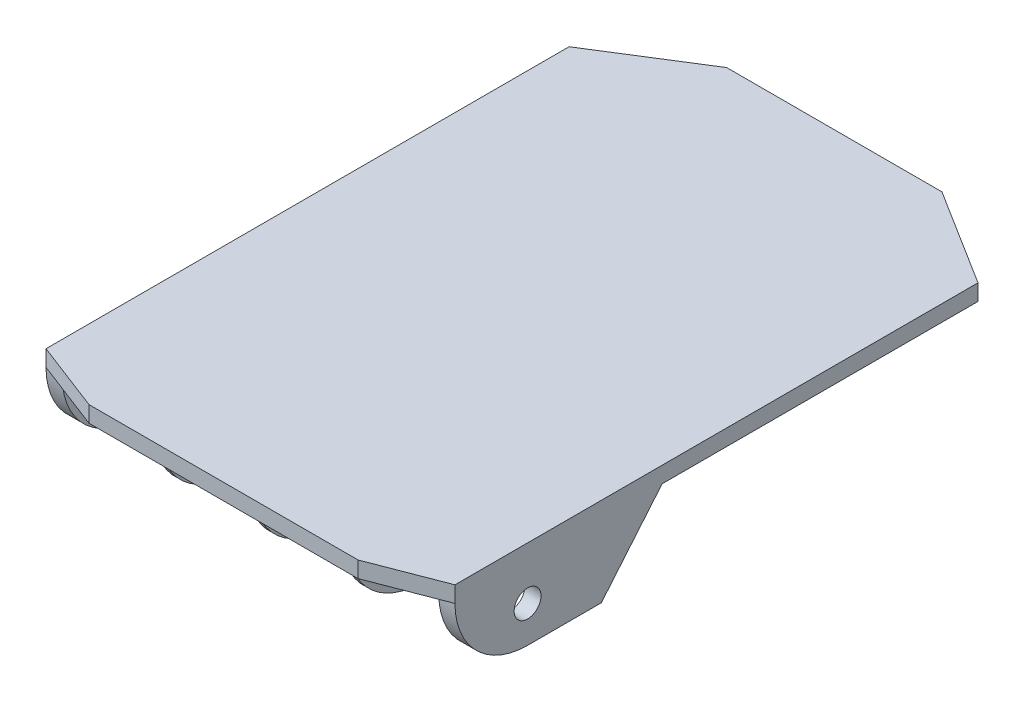
from build123d import *

# Parameters (mm, degrees)
BOSS_EXTRUDE1_DEPTH     = 38
CUT_EXTRUDE1_DEPTH      = 78.345006303
CUT_EXTRUDE1_DEPTH_BACK = 78.345006303
SKETCH2_OUTSIDE_W       = 105.518
SKETCH2_OUTSIDE_H       = 143.018
SHELL1_START            = -13.5
SHELL1_DEPTH            = 13.5
CUT_EXTRUDE2_DEPTH      = 78.345006303
CUT_EXTRUDE2_DEPTH_BACK = 78.345006303
SKETCH3_R               = 2.5
CUT_EXTRUDE3_DEPTH      = 38
SKETCH5_R               = 2.5
BOSS_EXTRUDE2_DEPTH     = 0.5
LPATTERN1_COUNT         = 3
LPATTERN1_PITCH         = 17.5
SKETCH7_W               = 70
SKETCH7_H               = 64.783051232
BOSS_EXTRUDE3_DEPTH     = 3


# Read off the part's stored shape, not the designer's step: Shell1
with BuildPart() as part:
    # Sketch1 → Boss-Extrude1 (new, symmetric)
    with BuildSketch(Plane(origin=(0, 0, 0), x_dir=(0, 0, -1), z_dir=(1, 0, 0))):
        with BuildLine():
            Line((-61, 0), (-66, 0))
            Line((-66, 0), (-66, 3))
            Line((-66, 3), (47.5, 3))
            Line((47.5, 3), (47.5, 0))
            Line((47.5, 0), (36.207291717, -13.5))
            Line((36.207291717, -13.5), (-47.5, -13.5))
            ThreePointArc((-47.5, -13.5), (-57.045941546, -9.545941546), (-61, 0))
        make_face()
    extrude(amount=BOSS_EXTRUDE1_DEPTH, both=True)

    # Sketch2 outside → Cut-Extrude1 (cut, two sides: drawn at the far end of the back side and taken through both)
    with BuildSketch(Plane(origin=(0, 0, 0), x_dir=(1, 0, 0), z_dir=(0, 1, 0)).offset(-CUT_EXTRUDE1_DEPTH_BACK)):
        with Locations((0, -9.25)):
            Rectangle(SKETCH2_OUTSIDE_W, SKETCH2_OUTSIDE_H)
        Polygon((-25, -66), (-38, -61), (-38, 36.207291717), (-20, 47.5), (20, 47.5), (38, 36.207291717), (38, -61), (25, -66), align=None, mode=Mode.SUBTRACT)
    extrude(amount=CUT_EXTRUDE1_DEPTH + CUT_EXTRUDE1_DEPTH_BACK, mode=Mode.SUBTRACT)

    # Shell1 outline → Shell1 (cut)
    with BuildSketch(Plane(origin=(0, 0, 0), x_dir=(1, 0, 0), z_dir=(0, 1, 0)).offset(SHELL1_START)):
        Polygon((19.136843791, 44.5), (-19.136843791, 44.5), (-35, 34.547889139), (-35, -68), (35, -68), (35, 34.547889139), align=None)
    extrude(amount=SHELL1_DEPTH, mode=Mode.SUBTRACT)

    # Sketch3 → Cut-Extrude2 (cut, two sides: drawn at the far end of the back side and taken through both)
    with BuildSketch(Plane(origin=(0, 0, 0), x_dir=(0, 0, -1), z_dir=(1, 0, 0)).offset(-CUT_EXTRUDE2_DEPTH_BACK)):
        with Locations((-47.5, -6.75)):
            Circle(SKETCH3_R)
    extrude(amount=CUT_EXTRUDE2_DEPTH + CUT_EXTRUDE2_DEPTH_BACK, mode=Mode.SUBTRACT)

    # Sketch4 → Cut-Extrude3 (cut)
    with BuildSketch(Plane(origin=(0, 0, 0), x_dir=(0, 0, -1), z_dir=(1, 0, 0))):
        Polygon((-22.5, 0), (47.5, 0), (36.207291717, -13.5), (-33.792708283, -13.5), align=None)
    extrude(amount=CUT_EXTRUDE3_DEPTH, mode=Mode.SUBTRACT)

    # Sketch5 → Boss-Extrude2 (add, symmetric)
    with BuildSketch(Plane(origin=(17.5, 0, 0), x_dir=(0, 0, -1), z_dir=(1, 0, 0))):
        with BuildLine():
            Line((-61, 0), (-32.281378795, 0))
            Line((-32.281378795, 0), (-43.618023888, -13.5))
            Line((-43.618023888, -13.5), (-47.5, -13.5))
            ThreePointArc((-47.5, -13.5), (-57.045941546, -9.545941546), (-61, 0))
        make_face()
        with Locations((-47.5, -6.75)):
            Circle(SKETCH5_R, mode=Mode.SUBTRACT)
    boss_extrude2 = extrude(amount=BOSS_EXTRUDE2_DEPTH, both=True)

    # LPattern1: Boss-Extrude2 ×3
    with Locations(*[(-i * LPATTERN1_PITCH, 0, 0) for i in range(1, LPATTERN1_COUNT)]):
        add(boss_extrude2)

    # Sketch7 → Boss-Extrude3 (add)
    with BuildSketch(Plane.XZ):
        with Locations((0, -1.970822706)):
            Rectangle(SKETCH7_W, SKETCH7_H)
    extrude(amount=BOSS_EXTRUDE3_DEPTH)


solid = part.part
